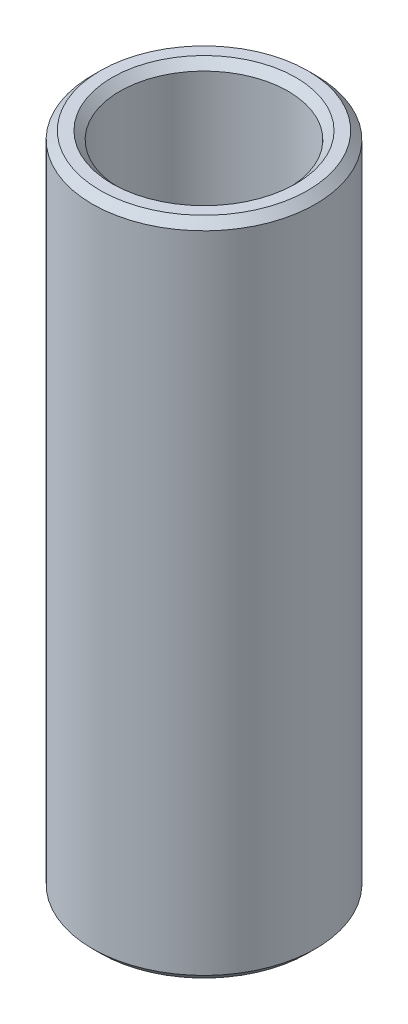
from build123d import *

# Parameters (mm, degrees)
SKETCH1_R           = 15
BOSS_EXTRUDE1_DEPTH = 88.76546866
SKETCH2_R           = 11.297743642
CUT_EXTRUDE1_DEPTH  = 92.265044932
CHAMFER1_SIZE       = 1.060646558


with BuildPart() as part:
    # Sketch1 → Boss-Extrude1 (new body)
    with BuildSketch(Plane(origin=(0, 0, 0), x_dir=(1, 0, 0), z_dir=(0, 1, 0))):
        Circle(SKETCH1_R)
    extrude(amount=BOSS_EXTRUDE1_DEPTH)

    # Sketch2 → Cut-Extrude1 (cut, through all)
    with BuildSketch(Plane(origin=(0, 0, 0), x_dir=(1, 0, 0), z_dir=(0, 1, 0))):
        Circle(SKETCH2_R)
    extrude(amount=CUT_EXTRUDE1_DEPTH, mode=Mode.SUBTRACT)

    # Chamfer1
    chamfer1_edges = [part.edges().sort_by_distance(p)[0] for p in [
        (-11.297743642, 88.76546866, 0),
        (-11.297743642, 0, 0),
        (-15, 0, 0),
        (-15, 88.76546866, 0),
    ]]
    chamfer(chamfer1_edges, length=CHAMFER1_SIZE)


solid = part.part
